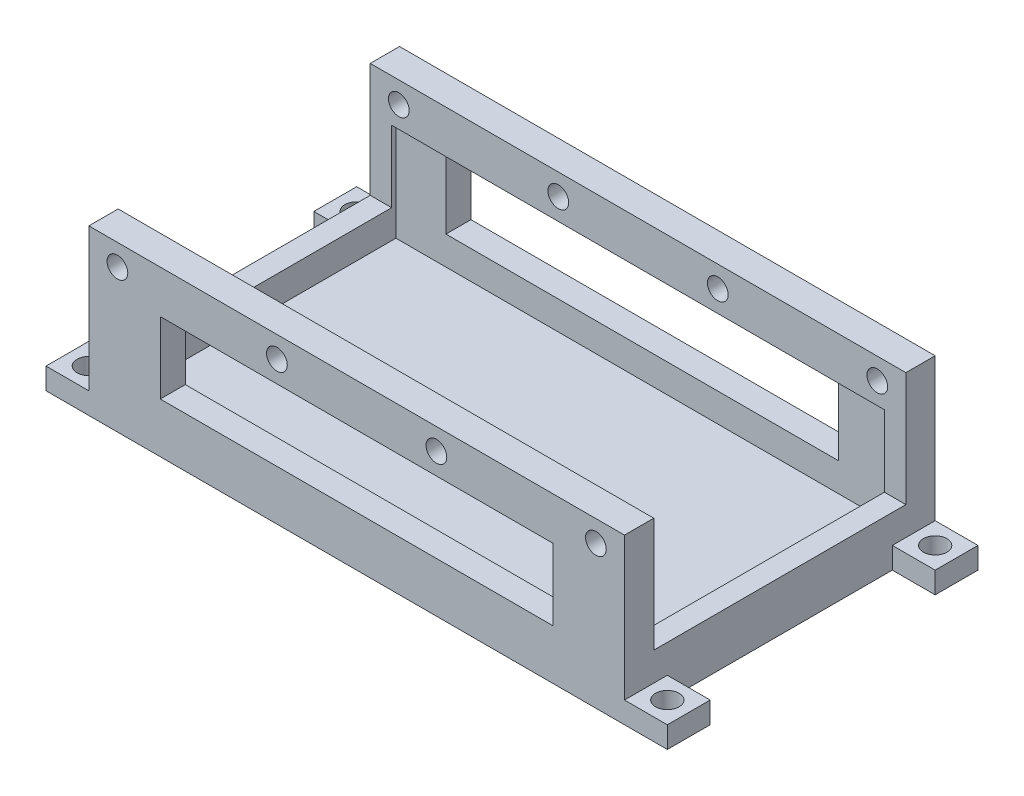
from build123d import *

# Parameters (mm, degrees)
SKETCH1_R           = 1.65
BOSS_EXTRUDE1_DEPTH = 3
SKETCH2_W           = 69
SKETCH2_H           = 36.5
BOSS_EXTRUDE2_DEPTH = 4
BOSS_EXTRUDE3_DEPTH = 10
SKETCH4_W           = 75
SKETCH4_H           = 4.1
BOSS_EXTRUDE4_DEPTH = 6
SKETCH5_R           = 1.45
CUT_EXTRUDE1_DEPTH  = 93.2239123


with BuildPart() as part:
    # Sketch1 → Boss-Extrude1 (new body)
    with BuildSketch(Plane(origin=(0, 0, 0), x_dir=(1, 0, 0), z_dir=(0, 1, 0))):
        Polygon((-78, 39.5), (-78, 33.5), (-72, 33.5), (-72, 2), (-78, 2), (-78, -4), (9, -4), (9, 2), (3, 2), (3, 33.5), (9, 33.5), (9, 39.5), align=None)
        with Locations((6, 36.5)):
            Circle(SKETCH1_R, mode=Mode.SUBTRACT)
        with Locations((6, -1)):
            Circle(SKETCH1_R, mode=Mode.SUBTRACT)
        with Locations((-75, -1)):
            Circle(SKETCH1_R, mode=Mode.SUBTRACT)
        with Locations((-75, 36.5)):
            Circle(SKETCH1_R, mode=Mode.SUBTRACT)
    extrude(amount=BOSS_EXTRUDE1_DEPTH)

    # Sketch2 → Boss-Extrude2 (add)
    with BuildSketch(Plane(origin=(0, 3, 0), x_dir=(1, 0, 0), z_dir=(0, 1, 0))):
        Polygon((-72, 39.5), (-72, 33.5), (-72, 2), (-72, -4), (3, -4), (3, 2), (3, 33.5), (3, 39.5), align=None)
        with Locations((-34.5, 17.75)):
            Rectangle(SKETCH2_W, SKETCH2_H, mode=Mode.SUBTRACT)
    extrude(amount=BOSS_EXTRUDE2_DEPTH)

    # Sketch3 → Boss-Extrude3 (add)
    with BuildSketch(Plane(origin=(0, 7, 0), x_dir=(1, 0, 0), z_dir=(0, 1, 0))):
        Polygon((3, -4), (3, 0.1), (0, 0.1), (0, -0.5), (-7, -0.5), (-7, -4), align=None)
        Polygon((3, 39.5), (-7, 39.5), (-7, 36), (0, 36), (0, 35.4), (3, 35.4), align=None)
        Polygon((-72, 39.5), (-72, 35.4), (-69, 35.4), (-69, 36), (-62, 36), (-62, 39.5), align=None)
        Polygon((-72, -4), (-62, -4), (-62, -0.5), (-69, -0.5), (-69, 0.1), (-72, 0.1), align=None)
    extrude(amount=BOSS_EXTRUDE3_DEPTH)

    # Sketch4 → Boss-Extrude4 (add)
    with BuildSketch(Plane(origin=(0, 17, 0), x_dir=(1, 0, 0), z_dir=(0, 1, 0))):
        with Locations((-34.5, 37.45)):
            Rectangle(SKETCH4_W, SKETCH4_H)
        with Locations((-34.5, -1.95)):
            Rectangle(SKETCH4_W, SKETCH4_H)
    extrude(amount=BOSS_EXTRUDE4_DEPTH)

    # Sketch5 → Cut-Extrude1 (cut, through all)
    with BuildSketch(Plane.XY.offset(4)):
        with Locations((-68, 20)):
            Circle(SKETCH5_R)
        with Locations((-45.666666667, 20)):
            Circle(SKETCH5_R)
        with Locations((-23.333333333, 20)):
            Circle(SKETCH5_R)
        with Locations((-1, 20)):
            Circle(SKETCH5_R)
    extrude(amount=-CUT_EXTRUDE1_DEPTH, mode=Mode.SUBTRACT)


solid = part.part
